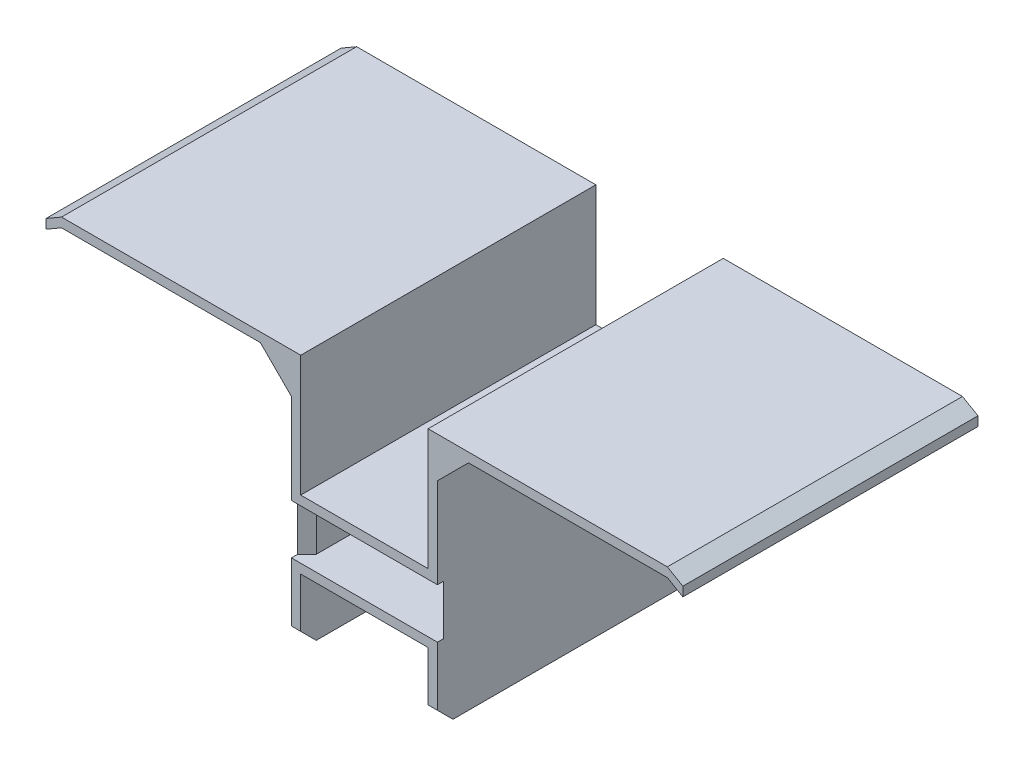
from build123d import *

# Parameters (mm, degrees)
SKETCH1_W                = 47
SKETCH1_H                = 42
BOSS_EXTRUDE1_DEPTH      = 95
SHELL1_T                 = -3
SKETCH2_W                = 95
SKETCH2_H                = 3
BOSS_EXTRUDE2_DEPTH      = 74
SKETCH3_W                = 3
SKETCH3_H                = 95
BOSS_EXTRUDE3_DEPTH      = 40
SKETCH4_W                = 95
SKETCH4_H                = 3
BOSS_EXTRUDE4_DEPTH      = 41
CHAMFER2_SIZE            = 5
CHAMFER3_SIZE            = 5
BOSS_EXTRUDE5_DEPTH      = 95
SKETCH10_W               = 10
SKETCH10_H               = 2
BOSS_EXTRUDE7_DEPTH      = 10
CHAMFER5_SIZE            = 10
CHAMFER5_OF_MIRROR5_SIZE = 10


# Some blends are built 0.0001 mm under size
with BuildPart() as part:
    # Sketch1 → Boss-Extrude1 (new body)
    with BuildSketch(Plane.XY):
        Rectangle(SKETCH1_W, SKETCH1_H)
    extrude(amount=BOSS_EXTRUDE1_DEPTH)

    # Shell1
    shell1_openings = [part.faces().sort_by_distance(p)[0] for p in [
        (0, 0, 95),
        (0, 0, 0),
        (0, 21, 47.5),
    ]]
    offset(amount=SHELL1_T, openings=shell1_openings, kind=Kind.INTERSECTION)

    # Sketch2 → Boss-Extrude2 (add)
    with BuildSketch(Plane.ZY.offset(23.5)):
        with Locations((47.5, 19.5)):
            Rectangle(SKETCH2_W, SKETCH2_H)
    boss_extrude2 = extrude(amount=BOSS_EXTRUDE2_DEPTH)

    # Mirror1: Boss-Extrude2 across plane
    add(boss_extrude2.mirror(Plane(origin=(0, 0, 0), x_dir=(0, 0, 1), z_dir=(1, 0, 0))))

    # Sketch3 → Boss-Extrude3 (add)
    with BuildSketch(Plane.XZ.offset(21)):
        with Locations((-22, 47.5)):
            Rectangle(SKETCH3_W, SKETCH3_H)
        with Locations((22, 47.5)):
            Rectangle(SKETCH3_W, SKETCH3_H)
    extrude(amount=BOSS_EXTRUDE3_DEPTH)

    # Sketch4 → Boss-Extrude4 (add)
    with BuildSketch(Plane.ZY.offset(-20.5)):
        with Locations((47.5, -38.5)):
            Rectangle(SKETCH4_W, SKETCH4_H)
    extrude(amount=BOSS_EXTRUDE4_DEPTH)

    # Chamfer2
    chamfer2_edges = [part.edges().sort_by_distance(p)[0] for p in [
        (-22, -61, 0),
        (-22, -61, 95),
        (22, -61, 95),
        (22, -61, 0),
    ]]
    chamfer(chamfer2_edges, length=CHAMFER2_SIZE)

    # Chamfer3
    # the kernel refuses this chamfer: 5 mm, written as the material it takes off along each edge
    with BuildSketch(Plane(origin=(-20.5, -21, 95), x_dir=(-0.9996219169112968, 0, 0.0274958766105877), z_dir=(0, -1, 0)), Plane(origin=(20.5, -21, 0), x_dir=(0.9996219169112968, 0, -0.027495876610586372), z_dir=(0, -1, 0))) as chamfer3_piece_1:
        Polygon((CHAMFER3_SIZE * 0.999621916911, CHAMFER3_SIZE * 0.0274958766106), (-CHAMFER3_SIZE * 0.0274958766106, CHAMFER3_SIZE * 0.999621916911), (0, 0), align=None)
    extrude(amount=16, mode=Mode.SUBTRACT)
    with BuildSketch(Plane(origin=(-20.5, -21, 0), x_dir=(-0.9996219169112968, 0, -0.027495876610586372), z_dir=(0, -1, 0)), Plane(origin=(20.5, -21, 95), x_dir=(0.9996219169112968, 0, 0.0274958766105877), z_dir=(0, -1, 0))) as chamfer3_piece_2:
        Polygon((CHAMFER3_SIZE * 0.999621916911, -CHAMFER3_SIZE * 0.0274958766106), (-CHAMFER3_SIZE * 0.0274958766106, -CHAMFER3_SIZE * 0.999621916911), (0, 0), align=None)
    extrude(amount=16, mode=Mode.SUBTRACT)

    # Sketch5 → Boss-Extrude5 (add)
    with BuildSketch(Plane(origin=(0, 0, 0), x_dir=(-1, 0, 0), z_dir=(0, 0, -1))):
        Polygon((97.5, 18), (97.5, 21), (102.5, 18.113248654), (102.5, 15.113248654), align=None)
    boss_extrude5 = extrude(amount=-BOSS_EXTRUDE5_DEPTH)

    # Mirror2: Boss-Extrude5 across plane
    add(boss_extrude5.mirror(Plane(origin=(0, 0, 0), x_dir=(0, 0, 1), z_dir=(1, 0, 0))))

    # Sketch10 → Boss-Extrude7 (add)
    with BuildSketch(Plane.XZ.offset(-18)):
        with Locations((-28.5, 94)):
            Rectangle(SKETCH10_W, SKETCH10_H)
        with Locations((-28.5, 1)):
            Rectangle(SKETCH10_W, SKETCH10_H)
    boss_extrude7 = extrude(amount=BOSS_EXTRUDE7_DEPTH)

    # Chamfer5
    chamfer5_edges = [part.edges().sort_by_distance(p)[0] for p in [
        (-33.5, 8, 94),
        (-33.5, 8, 1),
    ]]
    chamfer(chamfer5_edges, length=CHAMFER5_SIZE - 0.0001)  # a hair under: the kernel refuses the full size

    # Mirror5: Boss-Extrude7 across plane
    add(boss_extrude7.mirror(Plane(origin=(0, 0, 0), x_dir=(0, 0, 1), z_dir=(1, 0, 0))))

    # Chamfer5 of Mirror5
    chamfer5_of_mirror5_edges = [part.edges().sort_by_distance(p)[0] for p in [
        (33.5, 8, 94),
        (33.5, 8, 1),
    ]]
    chamfer(chamfer5_of_mirror5_edges, length=CHAMFER5_OF_MIRROR5_SIZE - 0.0001)  # a hair under: the kernel refuses the full size


solid = part.part
